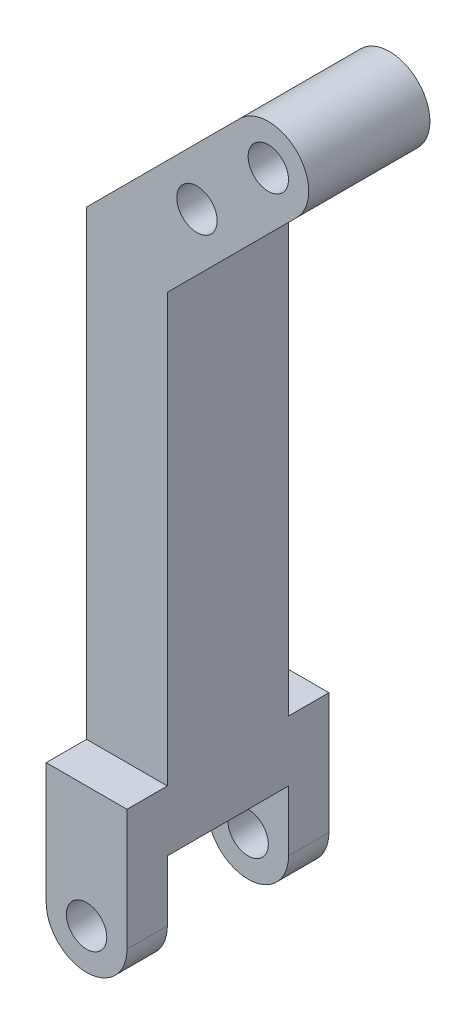
from build123d import *

# Parameters (mm, degrees)
SKETCH_1_R          = 20
SKETCH_1_R_2        = 10
EXTRUDE_1_DEPTH     = 60
EXTRUDE_2_DEPTH     = 30
SKETCH_4_R          = 10
EXTRUDE_3_DEPTH     = 20
SKETCH_8_R          = 10
CUT_EXTRUDE_1_DEPTH = 100


with BuildPart() as part:
    # 草图1 → 凸台-拉伸1 (new body)
    with BuildSketch(Plane.XY):
        Circle(SKETCH_1_R)
        Circle(SKETCH_1_R_2, mode=Mode.SUBTRACT)
    extrude(amount=EXTRUDE_1_DEPTH)

    # 草图2 → 凸台-拉伸2 (add, symmetric)
    with BuildSketch(Plane.XY.offset(30)):
        with BuildLine():
            Line((-14.142135624, 14.142135624), (-90, -61.715728753))
            Line((-90, -61.715728753), (-90, -320))
            Line((-90, -320), (-50, -320))
            Line((-50, -320), (-50, -78.284271247))
            Line((-50, -78.284271247), (14.142135624, -14.142135624))
            ThreePointArc((14.142135624, -14.142135624), (-14.142135624, -14.142135624), (-14.142135624, 14.142135624))
        make_face()
    extrude(amount=EXTRUDE_2_DEPTH, both=True)

    # 草图4 → 凸台-拉伸3 (add)
    with BuildSketch(Plane.XY.offset(60)):
        with BuildLine():
            Line((-90, -290), (-50, -290))
            Line((-50, -290), (-50, -350))
            ThreePointArc((-50, -350), (-70, -370), (-90, -350))
            Line((-90, -350), (-90, -290))
        make_face()
        with Locations((-70, -350)):
            Circle(SKETCH_4_R, mode=Mode.SUBTRACT)
    extrude_3 = extrude(amount=EXTRUDE_3_DEPTH)

    # 镜向1: 凸台-拉伸3 across plane
    add(extrude_3.mirror(Plane.XY.offset(30)))

    # 草图8 → 切除-拉伸1 (cut)
    with BuildSketch(Plane.XY.offset(60)):
        with Locations((-35.355339059, -35.355339059)):
            Circle(SKETCH_8_R)
    extrude(amount=-CUT_EXTRUDE_1_DEPTH, mode=Mode.SUBTRACT)


solid = part.part
